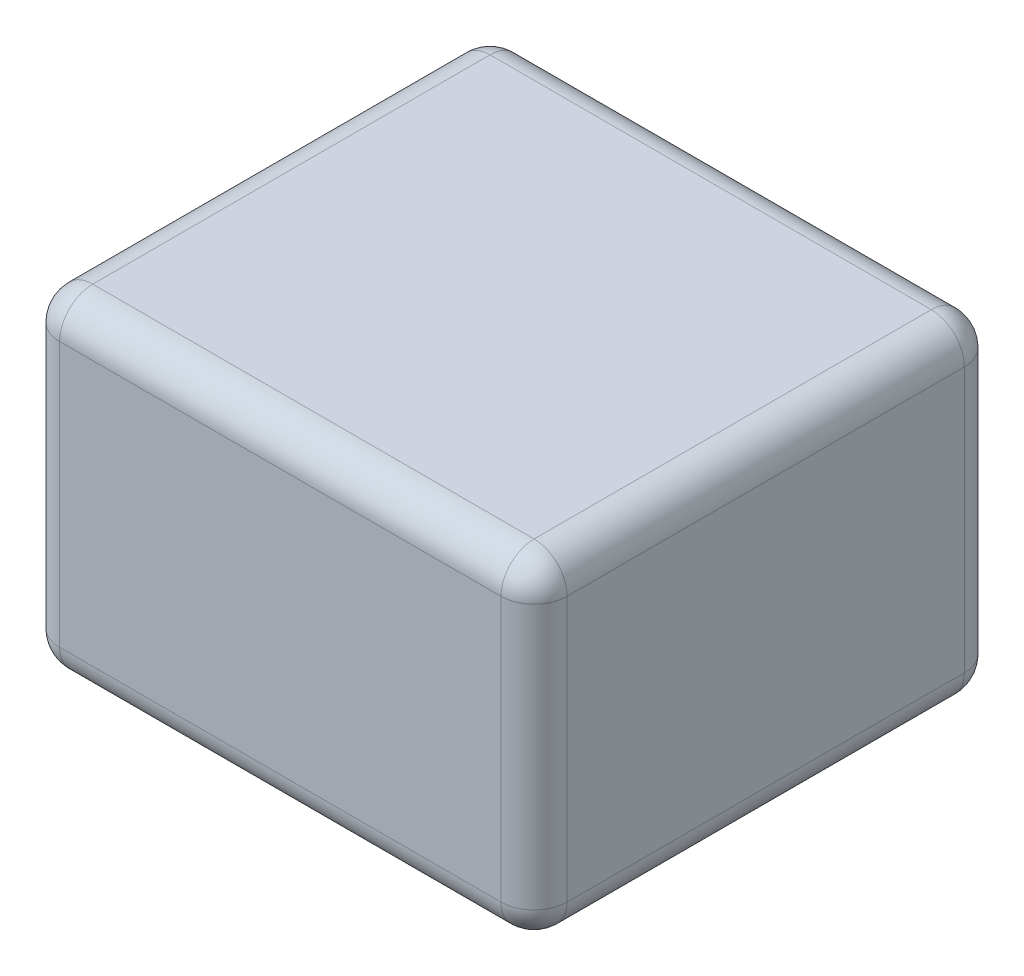
from build123d import *

# Parameters (mm, degrees)
SKETCH_1_W      = 46
SKETCH_1_H      = 30
EXTRUDE_1_DEPTH = 21
FILLET_1_R      = 3


with BuildPart() as part:
    # 草图1 → 凸台-拉伸1 (new, symmetric)
    with BuildSketch(Plane.XY):
        Rectangle(SKETCH_1_W, SKETCH_1_H)
    extrude(amount=EXTRUDE_1_DEPTH, both=True)

    # 圆角1
    fillet_1_edges = [part.edges().sort_by_distance(p)[0] for p in [
        (23, 0, -21),
        (0, 15, -21),
        (-23, 0, -21),
        (0, -15, -21),
        (23, 0, 21),
        (0, 15, 21),
        (-23, 0, 21),
        (0, -15, 21),
        (23, -15, 0),
        (-23, -15, 0),
        (-23, 15, 0),
        (23, 15, 0),
    ]]
    fillet(fillet_1_edges, radius=FILLET_1_R)


solid = part.part
